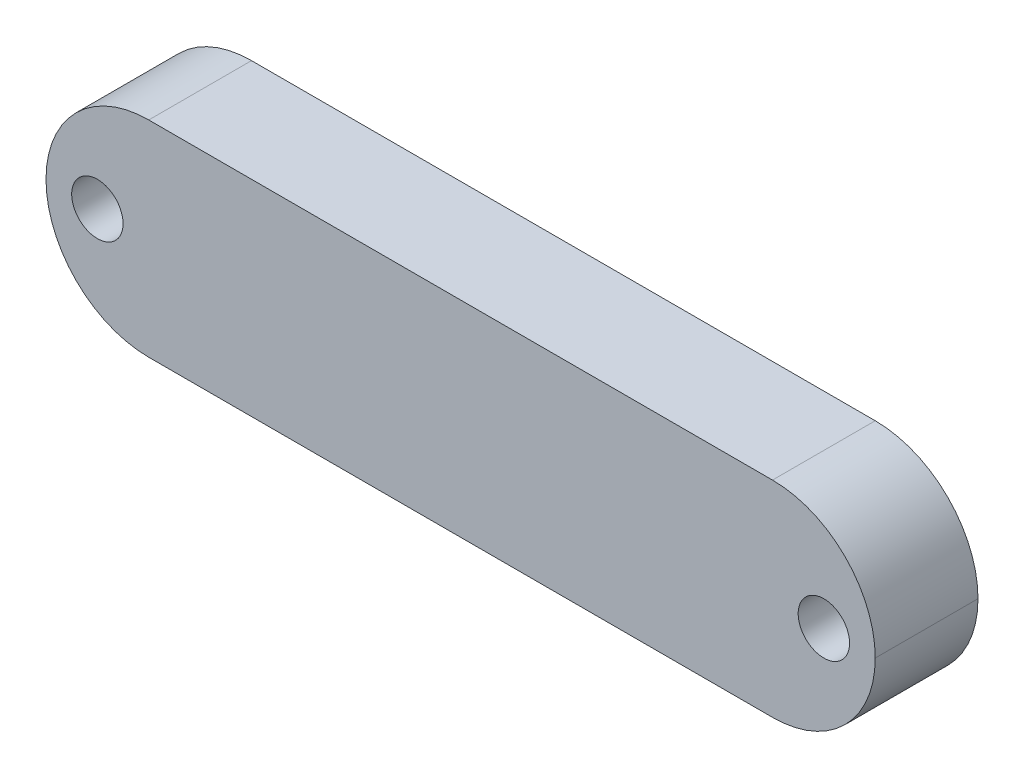
from build123d import *

# Parameters (mm, degrees)
SKETCH1_W           = 80.7
SKETCH1_H           = 20
SKETCH1_R           = 2.5
BOSS_EXTRUDE1_DEPTH = 10
FILLET1_R           = 10


with BuildPart() as part:
    # Sketch1 → Boss-Extrude1 (new body)
    with BuildSketch(Plane.XY):
        Rectangle(SKETCH1_W, SKETCH1_H)
        with Locations((-35.35, 0)):
            Circle(SKETCH1_R, mode=Mode.SUBTRACT)
        with Locations((35.35, 0)):
            Circle(SKETCH1_R, mode=Mode.SUBTRACT)
    extrude(amount=BOSS_EXTRUDE1_DEPTH)

    # Fillet1
    fillet1_edges = [part.edges().sort_by_distance(p)[0] for p in [
        (40.35, -10, 5),
        (40.35, 10, 5),
        (-40.35, -10, 5),
        (-40.35, 10, 5),
    ]]
    fillet(fillet1_edges, radius=FILLET1_R - 0.0001)  # a hair under: the kernel refuses the full size


solid = part.part
